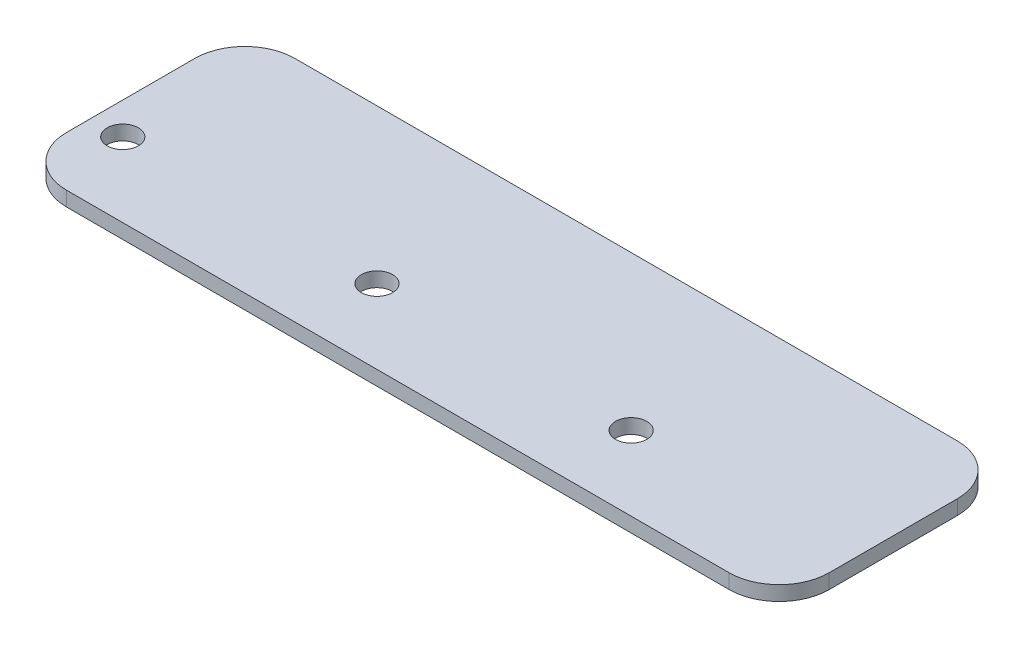
from build123d import *

# Parameters (mm, degrees)
SKETCH1_W                    = 60.96
SKETCH1_H                    = 10
BASE_FLANGE1_DEPTH           = 1.1684
EDGE_FLANGE1_STRIP_W         = 7.0104
EDGE_FLANGE1_STRIP_H         = 1.1684
EDGE_FLANGE1_STRIP_CUT_DEPTH = 60.96
EDGE_FLANGE1_DEPTH           = 60.96
TAP_DRILL_FOR_M3X0_5_TAP1_D  = 2.5
FILLET1_DEPTH                = 60.96
FILLET1_2_DEPTH              = 60.96
FILLET1_START                = -2
FILLET1_3_DEPTH              = 3


with BuildPart() as part:
    # Base-Flange1: sheet metal written as solids
    # Sketch1 → Base-Flange1 (new body)
    with BuildSketch(Plane(origin=(0, 0, 0), x_dir=(1, 0, 0), z_dir=(0, 1, 0))):
        with Locations((30.48, 5)):
            Rectangle(SKETCH1_W, SKETCH1_H)
    extrude(amount=-BASE_FLANGE1_DEPTH)

    # Edge-Flange1: sheet metal written as solids
    # Edge-Flange1 strip (on a plane across the edge) → Edge-Flange1 strip cut (cut)
    with BuildSketch(Plane(origin=(0, -1.1684, -10), x_dir=(0, 0, 1), z_dir=(1, 0, 0))):
        with Locations((-1.1684, -0.5842)):
            Rectangle(EDGE_FLANGE1_STRIP_W, EDGE_FLANGE1_STRIP_H)
    extrude(amount=EDGE_FLANGE1_STRIP_CUT_DEPTH, mode=Mode.SUBTRACT)

    # Edge-Flange1 section (on a plane across the edge) → Edge-Flange1 (add)
    with BuildSketch(Plane(origin=(0, -1.1684, -10), x_dir=(0, 0, 1), z_dir=(1, 0, 0))):
        with BuildLine():
            Line((0, 1.1684), (0, 9))
            Line((0, 9), (1.1684, 9))
            Line((1.1684, 9), (1.1684, 1.1684))
            ThreePointArc((1.1684, 1.1684), (1.510616437, 0.342216437), (2.3368, 0))
            Line((2.3368, 0), (2.3368, -1.1684))
            ThreePointArc((2.3368, -1.1684), (0.684432874, -0.483967126), (0, 1.1684))
        make_face()
    extrude(amount=EDGE_FLANGE1_DEPTH)

    # Tap Drill for M3x0.5 Tap1 (through all)
    with Locations(Plane(origin=(0, -1.1684, 0), x_dir=(-1, 0, 0), z_dir=(0, -1, 0))):
        with Locations((-2.55, 5.94), (-22.87, 5.94), (-43.19, 5.94)):
            Hole(TAP_DRILL_FOR_M3X0_5_TAP1_D / 2)

    # Fillet1: read off the stored shape, not the designer's step
    # Fillet1 outline → Fillet1 (cut)
    with BuildSketch(Plane.YZ):
        with BuildLine():
            ThreePointArc((-2.3368, -10), (-1.731991655, -9.920375471), (-1.1684, -9.686928163))
            Line((-1.1684, -9.686928163), (-1.1684, -7.6632))
            ThreePointArc((-1.1684, -7.6632), (-1.510616437, -8.489383563), (-2.3368, -8.8316))
            Line((-2.3368, -8.8316), (-10.1684, -8.8316))
            Line((-10.1684, -8.8316), (-10.1684, -10))
            Line((-10.1684, -10), (-2.3368, -10))
        make_face()
    extrude(amount=FILLET1_DEPTH, mode=Mode.SUBTRACT)

    # Fillet1 2 outline → Fillet1 2 (add)
    with BuildSketch(Plane.YZ):
        with BuildLine():
            Line((0, -18.247777642), (0, -7.6632))
            ThreePointArc((0, -7.6632), (-0.313071837, -8.8316), (-1.1684, -9.686928163))
            Line((-1.1684, -9.686928163), (-1.1684, -18.247777642))
            Line((-1.1684, -18.247777642), (0, -18.247777642))
        make_face()
    extrude(amount=FILLET1_2_DEPTH)

    # Fillet1 3 outline → Fillet1 3 (cut)
    with BuildSketch(Plane(origin=(0, 0, 0), x_dir=(1, 0, 0), z_dir=(0, 1, 0)).offset(FILLET1_START)):
        with BuildLine():
            Line((60.96, 18.247777642), (56.96, 18.247777642))
            ThreePointArc((56.96, 18.247777642), (59.788427125, 17.076204767), (60.96, 14.247777642))
            Line((60.96, 14.247777642), (60.96, 18.247777642))
        make_face()
        with BuildLine():
            ThreePointArc((0, 14.247777642), (1.171572875, 17.076204767), (4, 18.247777642))
            Line((4, 18.247777642), (0, 18.247777642))
            Line((0, 18.247777642), (0, 14.247777642))
        make_face()
        with BuildLine():
            Line((60.96, 0), (60.96, 4))
            ThreePointArc((60.96, 4), (59.788427125, 1.171572875), (56.96, 0))
            Line((56.96, 0), (60.96, 0))
        make_face()
        with BuildLine():
            ThreePointArc((4, 0), (1.171572875, 1.171572875), (0, 4))
            Line((0, 4), (0, 0))
            Line((0, 0), (4, 0))
        make_face()
    extrude(amount=FILLET1_3_DEPTH, mode=Mode.SUBTRACT)


solid = part.part
